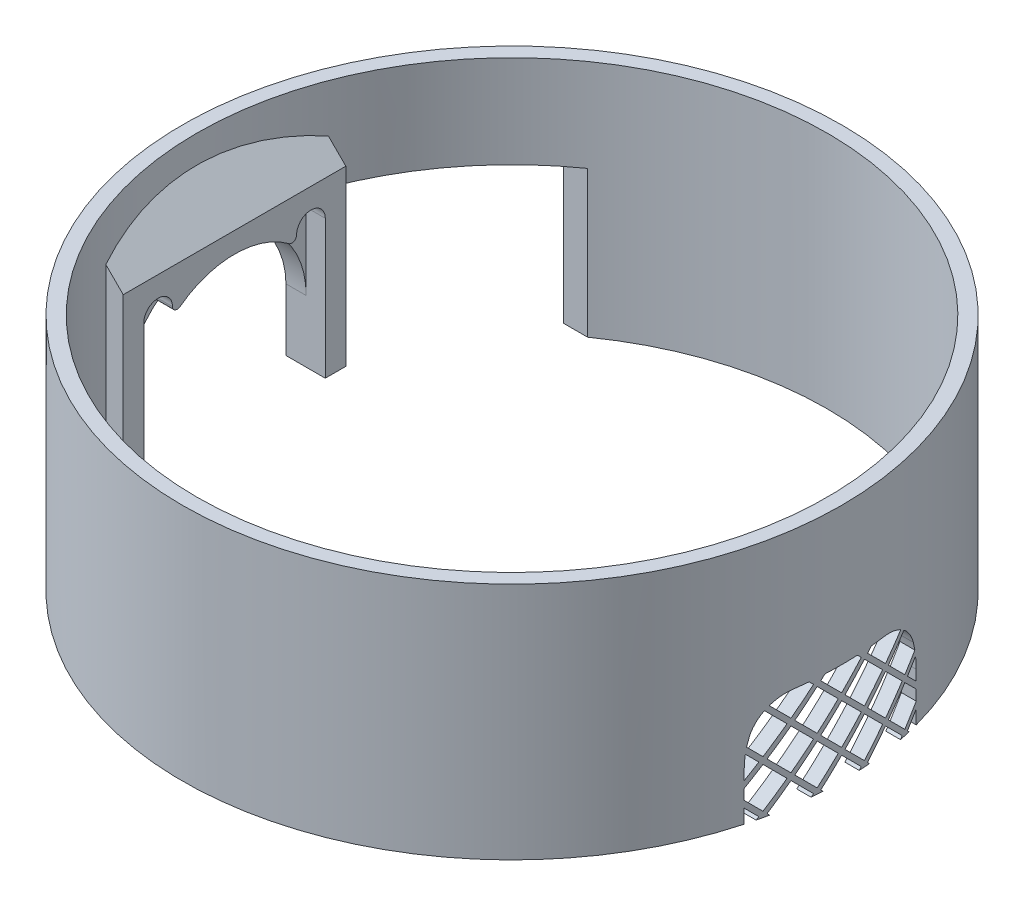
from build123d import *

# Parameters (mm, degrees)
SKETCH1_R           = 69
SKETCH1_R_2         = 66
BOSS_EXTRUDE1_DEPTH = 50
SKETCH4_W           = 30.6
SKETCH4_H           = 30.6
CUT_EXTRUDE2_DEPTH  = 110.644881321
CUT_EXTRUDE6_DEPTH  = 110.644881321
BOSS_EXTRUDE2_REACH = 169.745
BOSS_EXTRUDE2_START = -58.1
SKETCH8_W           = 46.6
SKETCH8_H           = 35
BOSS_EXTRUDE4_DEPTH = 30
SKETCH9_OUTSIDE_W   = 206.079
SKETCH9_OUTSIDE_H   = 183.51
SKETCH9_OUTSIDE_R   = 69
CUT_EXTRUDE7_DEPTH  = 126.083349102
CUT_EXTRUDE8_DEPTH  = 110.644881321
CUT_EXTRUDE9_DEPTH  = 110.644881321
CUT_EXTRUDE11_DEPTH = 4
FILLET3_R           = 1
CUT_EXTRUDE13_DEPTH = 110.644881493


with BuildPart() as part:
    # Sketch1 → Boss-Extrude1 (new body)
    with BuildSketch(Plane(origin=(0, 0, 0), x_dir=(1, 0, 0), z_dir=(0, 1, 0))):
        Circle(SKETCH1_R)
        Circle(SKETCH1_R_2, mode=Mode.SUBTRACT)
    extrude(amount=BOSS_EXTRUDE1_DEPTH)

    # Sketch4 → Cut-Extrude2 (cut, through all)
    with BuildSketch(Plane(origin=(0, 0, 0), x_dir=(0, 0, -1), z_dir=(1, 0, 0))):
        with Locations((38.6, 15.3)):
            Rectangle(SKETCH4_W, SKETCH4_H)
    extrude(amount=-CUT_EXTRUDE2_DEPTH, mode=Mode.SUBTRACT)

    # Sketch5 → Cut-Extrude6 (cut, through all)
    with BuildSketch(Plane(origin=(0, 0, 0), x_dir=(0, 0, -1), z_dir=(1, 0, 0))):
        with BuildLine():
            Line((19, 13), (19, -6))
            Line((19, -6), (-19, -6))
            Line((-19, -6), (-19, 13))
            ThreePointArc((-19, 13), (0, 32), (19, 13))
        make_face()
    extrude(amount=-CUT_EXTRUDE6_DEPTH, mode=Mode.SUBTRACT)

    # Sketch6 → Boss-Extrude2 (add, up to next)
    with BuildSketch(Plane(origin=(0, 0, 0), x_dir=(0, 0, -1), z_dir=(1, 0, 0)).offset(BOSS_EXTRUDE2_START), mode=Mode.PRIVATE) as boss_extrude2_sk1:
        with BuildLine():
            Line((19, 13), (19, 0))
            Line((19, 0), (23.3, 0))
            Line((23.3, 0), (23.3, 13))
            ThreePointArc((23.3, 13), (0, 36.3), (-23.3, 13))
            Line((-23.3, 13), (-23.3, 0))
            Line((-23.3, 0), (-19, 0))
            Line((-19, 0), (-19, 13))
            ThreePointArc((-19, 13), (0, 32), (19, 13))
        make_face()
    boss_extrude2_tool1 = extrude(boss_extrude2_sk1.sketch, amount=-BOSS_EXTRUDE2_REACH, mode=Mode.PRIVATE) - part.part
    add(boss_extrude2_tool1.solids().sort_by_distance((-58.1, 6.5, 22.709301))[0])

    # Sketch8 → Boss-Extrude4 (add)
    with BuildSketch(Plane(origin=(-10.9, -10.9, 0), x_dir=(0, 0, -1), z_dir=(-0.7071067811865512, -0.7071067811865438, 0))):
        with Locations((0, -66.582903987)):
            Rectangle(SKETCH8_W, SKETCH8_H)
    extrude(amount=BOSS_EXTRUDE4_DEPTH)

    # Sketch9 outside → Cut-Extrude7 (cut, through all)
    with BuildSketch(Plane.XZ):
        with Locations((-11.2845, 0)):
            Rectangle(SKETCH9_OUTSIDE_W, SKETCH9_OUTSIDE_H)
        Circle(SKETCH9_OUTSIDE_R, mode=Mode.SUBTRACT)
    extrude(amount=-CUT_EXTRUDE7_DEPTH, mode=Mode.SUBTRACT)

    # Sketch9<3> → Cut-Extrude8 (cut, through all)
    with BuildSketch(Plane.XZ):
        with BuildLine():
            Line((-58.1, -19), (-58.1, -23.3))
            Line((-58.1, -23.3), (-61.750384614, -23.3))
            ThreePointArc((-61.750384614, -23.3), (-52.211852364, -40.372298334), (-38.089237325, -53.9))
            ThreePointArc((-38.089237325, -53.9), (63.102674486, 19.340436209), (-61.750384614, 23.3))
            Line((-61.750384614, 23.3), (-58.1, 23.3))
            Line((-58.1, 23.3), (-58.1, 19))
            Line((-58.1, 19), (-58.1, -19))
        make_face()
    extrude(amount=-CUT_EXTRUDE8_DEPTH, mode=Mode.SUBTRACT)

    # Sketch5<2> → Cut-Extrude9 (cut, through all)
    with BuildSketch(Plane(origin=(0, 0, 0), x_dir=(0, 0, -1), z_dir=(1, 0, 0))):
        with BuildLine():
            Line((19, 13), (19, -6))
            Line((19, -6), (-19, -6))
            Line((-19, -6), (-19, 13))
            ThreePointArc((-19, 13), (0, 32), (19, 13))
        make_face()
    extrude(amount=-CUT_EXTRUDE9_DEPTH, mode=Mode.SUBTRACT)

    # Sketch11 → Cut-Extrude11 (cut)
    with BuildSketch(Plane(origin=(-58.1, 0, 0), x_dir=(0, 0, -1), z_dir=(1, 0, 0))):
        with BuildLine():
            Line((-19.000000298, 29.000000238), (-19, 11.000000238))
            Line((-19, 11.000000238), (-13.000000298, 11.000000238))
            Line((-13.000000298, 11.000000238), (-13.000000298, 29.000000238))
            ThreePointArc((-13.000000298, 29.000000238), (-16.000000298, 32.000000238), (-19.000000298, 29.000000238))
        make_face()
        with BuildLine():
            Line((12.999999702, 29.000000238), (12.999999702, 11.000000238))
            Line((12.999999702, 11.000000238), (19, 11.000000238))
            Line((19, 11.000000238), (18.999999702, 29.000000238))
            ThreePointArc((18.999999702, 29.000000238), (15.999999702, 32.000000238), (12.999999702, 29.000000238))
        make_face()
    extrude(amount=-CUT_EXTRUDE11_DEPTH, mode=Mode.SUBTRACT)

    # Fillet3
    fillet3_edges = [part.edges().sort_by_distance(p)[0] for p in [
        (-60.1, 26.85640674, -12.999999702),
        (-60.1, 26.856406181, 13.000000298),
    ]]
    fillet(fillet3_edges, radius=FILLET3_R)

    # Sketch12 → Cut-Extrude13 (cut, through all)
    with BuildSketch(Plane(origin=(0, 0, 0), x_dir=(0, 0, -1), z_dir=(1, 0, 0))):
        Polygon((-18, 2.899494937), (-18, -0.9), (-16.912193309, -0.9), (-15.556349186, 0.455844123), align=None)
        Polygon((-14.849242405, -0.251262658), (-15.497979746, -0.9), (-14.200505063, -0.9), align=None)
        Polygon((-18, 6.497474683), (-18, 4.313708499), (-14.849242405, 1.162950904), (-10.606601718, 5.405591591), (-14.849242405, 9.648232278), align=None)
        Polygon((-14.142135624, 0.455844123), (-12.786291501, -0.9), (-7.012698372, -0.9), (-5.656854249, 0.455844123), (-9.899494937, 4.69848481), align=None)
        with BuildLine():
            Line((-18, 10.1), (-18, 7.911688245))
            Line((-18, 7.911688245), (-15.556349186, 10.355339059))
            Line((-15.556349186, 10.355339059), (-17.822514472, 12.621504345))
            ThreePointArc((-17.822514472, 12.621504345), (-17.955573837, 11.363871563), (-18, 10.1))
        make_face()
        Polygon((-4.949747468, -0.251262658), (-5.59848481, -0.9), (-4.301010127, -0.9), align=None)
        with BuildLine():
            ThreePointArc((-17.170905626, 15.500001244), (-17.410936745, 14.667197503), (-17.61060152, 13.823804956))
            Line((-17.61060152, 13.823804956), (-14.849242405, 11.062445841))
            Line((-14.849242405, 11.062445841), (-10.606601718, 15.305086528))
            Line((-10.606601718, 15.305086528), (-14.598625312, 19.297110122))
            ThreePointArc((-14.598625312, 19.297110122), (-16.162704874, 17.586840529), (-17.170905626, 15.500001244))
        make_face()
        Polygon((-4.242640687, 0.455844123), (-2.886796564, -0.9), (2.886796564, -0.9), (4.242640687, 0.455844123), (0, 4.69848481), align=None)
        Polygon((4.949747468, -0.251262658), (4.301010127, -0.9), (5.59848481, -0.9), align=None)
        with BuildLine():
            ThreePointArc((-9.539392014, 21.100001244), (-11.742028587, 20.790800431), (-13.774400904, 19.887099276))
            Line((-13.774400904, 19.887099276), (-9.899494937, 16.012193309))
            Line((-9.899494937, 16.012193309), (-5.656854249, 20.254833996))
            Line((-5.656854249, 20.254833996), (-6.502021497, 21.100001244))
            Line((-6.502021497, 21.100001244), (-9.539392014, 21.100001244))
        make_face()
        Polygon((5.656854249, 0.455844123), (7.012698372, -0.9), (12.786291501, -0.9), (14.142135624, 0.455844123), (9.899494937, 4.69848481), align=None)
        Polygon((14.849242405, -0.251262658), (14.200505063, -0.9), (15.497979746, -0.9), align=None)
        Polygon((3.397473439, 21.100001244), (-3.397473439, 21.100001244), (-4.242640687, 20.254833996), (0, 16.012193309), (4.242640687, 20.254833996), align=None)
        Polygon((15.556349182, 0.455844127), (16.912193309, -0.9), (18, -0.9), (18.000000006, 2.899494943), align=None)
        Polygon((14.8492424, 1.162950909), (18.000000008, 4.313708507), (18.000000012, 6.497474672), (14.849242412, 9.648232281), (10.606601719, 5.405591603), align=None)
        with BuildLine():
            Line((9.539392014, 21.100001244), (6.502021497, 21.100001244))
            Line((6.502021497, 21.100001244), (5.656854249, 20.254833996))
            Line((5.656854249, 20.254833996), (9.899494937, 16.012193309))
            Line((9.899494937, 16.012193309), (13.774400907, 19.887099279))
            ThreePointArc((13.774400909, 19.887099283), (11.742028589, 20.790800435), (9.539392014, 21.100001244))
        make_face()
        with BuildLine():
            Line((15.55634919, 10.355339063), (18.000000014, 7.911688232))
            Line((18.000000014, 7.911688232), (18.000000017, 10.1))
            ThreePointArc((18.000000017, 10.1), (17.955573855, 11.363871569), (17.822514488, 12.621504357))
            Line((17.822514483, 12.621504357), (15.55634919, 10.355339063))
        make_face()
        with BuildLine():
            ThreePointArc((17.170905634, 15.500001246), (16.162704882, 17.586840534), (14.598625318, 19.297110128))
            Line((14.598625315, 19.297110125), (10.606601718, 15.305086528))
            Line((10.606601718, 15.305086528), (14.849242405, 11.062445841))
            Line((14.849242405, 11.062445841), (17.610601531, 13.823804967))
            ThreePointArc((17.610601533, 13.823804967), (17.410936756, 14.66719751), (17.170905634, 15.500001246))
        make_face()
        Polygon((4.949747468, 1.162950904), (9.192388155, 5.405591591), (4.949747468, 9.648232278), (0.707106781, 5.405591591), align=None)
        Polygon((9.899494937, 6.112698372), (14.142135624, 10.355339059), (9.899494937, 14.597979746), (5.656854249, 10.355339059), align=None)
        Polygon((-4.949747468, 1.162950904), (-0.707106781, 5.405591591), (-4.949747468, 9.648232278), (-9.192388155, 5.405591591), align=None)
        Polygon((0, 6.112698372), (4.242640687, 10.355339059), (0, 14.597979746), (-4.242640687, 10.355339059), align=None)
        Polygon((4.949747468, 11.062445841), (9.192388155, 15.305086528), (4.949747468, 19.547727215), (0.707106781, 15.305086528), align=None)
        Polygon((-9.899494937, 6.112698372), (-5.656854249, 10.355339059), (-9.899494937, 14.597979746), (-14.142135624, 10.355339059), align=None)
        Polygon((-4.949747468, 11.062445841), (-0.707106781, 15.305086528), (-4.949747468, 19.547727215), (-9.192388155, 15.305086528), align=None)
    extrude(amount=CUT_EXTRUDE13_DEPTH, mode=Mode.SUBTRACT)


solid = part.part
